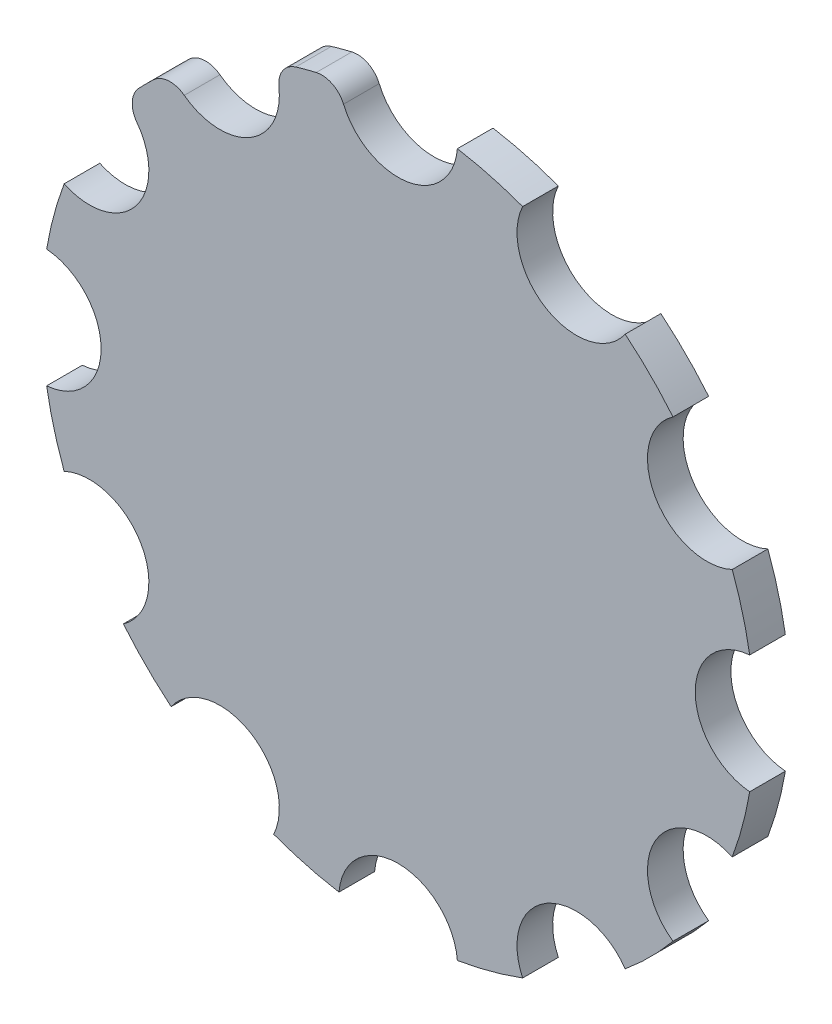
from build123d import *

# Parameters (mm, degrees)
BOSS_EXTRUDE1_DEPTH = 3
FILLET1_R           = 2


with BuildPart() as part:
    # Sketch1 → Boss-Extrude1 (new body)
    with BuildSketch(Plane.XY):
        with BuildLine():
            ThreePointArc((29.583333333, -4.982608643), (25, 0), (29.583333333, 4.982608643))
            ThreePointArc((29.583333333, 4.982608643), (28.977774789, 7.764571353), (28.111222517, 10.476601005))
            ThreePointArc((28.111222517, 10.476601005), (21.650635095, 12.5), (23.128613874, 19.106732329))
            ThreePointArc((23.128613874, 19.106732329), (21.213203436, 21.213203436), (19.106732329, 23.128613874))
            ThreePointArc((19.106732329, 23.128613874), (12.5, 21.650635095), (10.476601005, 28.111222517))
            ThreePointArc((10.476601005, 28.111222517), (7.764571353, 28.977774789), (4.982608643, 29.583333333))
            ThreePointArc((4.982608643, 29.583333333), (0, 25), (-4.982608643, 29.583333333))
            ThreePointArc((-4.982608643, 29.583333333), (-7.764571353, 28.977774789), (-10.476601005, 28.111222517))
            ThreePointArc((-10.476601005, 28.111222517), (-10.120604803, 27.072321783), (-10, 25.980762114))
            ThreePointArc((-10, 25.980762114), (-13.505620805, 21.209302083), (-19.106732329, 23.128613874))
            ThreePointArc((-19.106732329, 23.128613874), (-21.213203436, 21.213203436), (-23.128613874, 19.106732329))
            ThreePointArc((-23.128613874, 19.106732329), (-21.550144707, 17.317246081), (-20.980762114, 15))
            ThreePointArc((-20.980762114, 15), (-23.302357926, 10.777897324), (-28.111222517, 10.476601005))
            ThreePointArc((-28.111222517, 10.476601005), (-28.977774789, 7.764571353), (-29.583333333, 4.982608643))
            ThreePointArc((-29.583333333, 4.982608643), (-26.320099639, 3.385016002), (-25, 0))
            ThreePointArc((-25, 0), (-26.320099639, -3.385016002), (-29.583333333, -4.982608643))
            ThreePointArc((-29.583333333, -4.982608643), (-28.977774789, -7.764571353), (-28.111222517, -10.476601005))
            ThreePointArc((-28.111222517, -10.476601005), (-23.302357926, -10.777897324), (-20.980762114, -15))
            ThreePointArc((-20.980762114, -15), (-21.550144707, -17.317246081), (-23.128613874, -19.106732329))
            ThreePointArc((-23.128613874, -19.106732329), (-21.213203436, -21.213203436), (-19.106732329, -23.128613874))
            ThreePointArc((-19.106732329, -23.128613874), (-13.505620805, -21.209302083), (-10, -25.980762114))
            ThreePointArc((-10, -25.980762114), (-10.120604803, -27.072321783), (-10.476601005, -28.111222517))
            ThreePointArc((-10.476601005, -28.111222517), (-7.764571353, -28.977774789), (-4.982608643, -29.583333333))
            ThreePointArc((-4.982608643, -29.583333333), (0, -25), (4.982608643, -29.583333333))
            ThreePointArc((4.982608643, -29.583333333), (7.764571353, -28.977774789), (10.476601005, -28.111222517))
            ThreePointArc((10.476601005, -28.111222517), (12.5, -21.650635095), (19.106732329, -23.128613874))
            ThreePointArc((19.106732329, -23.128613874), (21.213203436, -21.213203436), (23.128613874, -19.106732329))
            ThreePointArc((23.128613874, -19.106732329), (21.650635095, -12.5), (28.111222517, -10.476601005))
            ThreePointArc((28.111222517, -10.476601005), (28.977774789, -7.764571353), (29.583333333, -4.982608643))
        make_face()
    extrude(amount=BOSS_EXTRUDE1_DEPTH)

    # Fillet1
    fillet1_edges = [part.edges().sort_by_distance(p)[0] for p in [
        (-23.128613874, 19.106732329, 1.5),
        (-19.106732329, 23.128613874, 1.5),
        (-4.982608643, 29.583333333, 1.5),
        (-10.476601005, 28.111222517, 1.5),
    ]]
    fillet(fillet1_edges, radius=FILLET1_R)


solid = part.part
